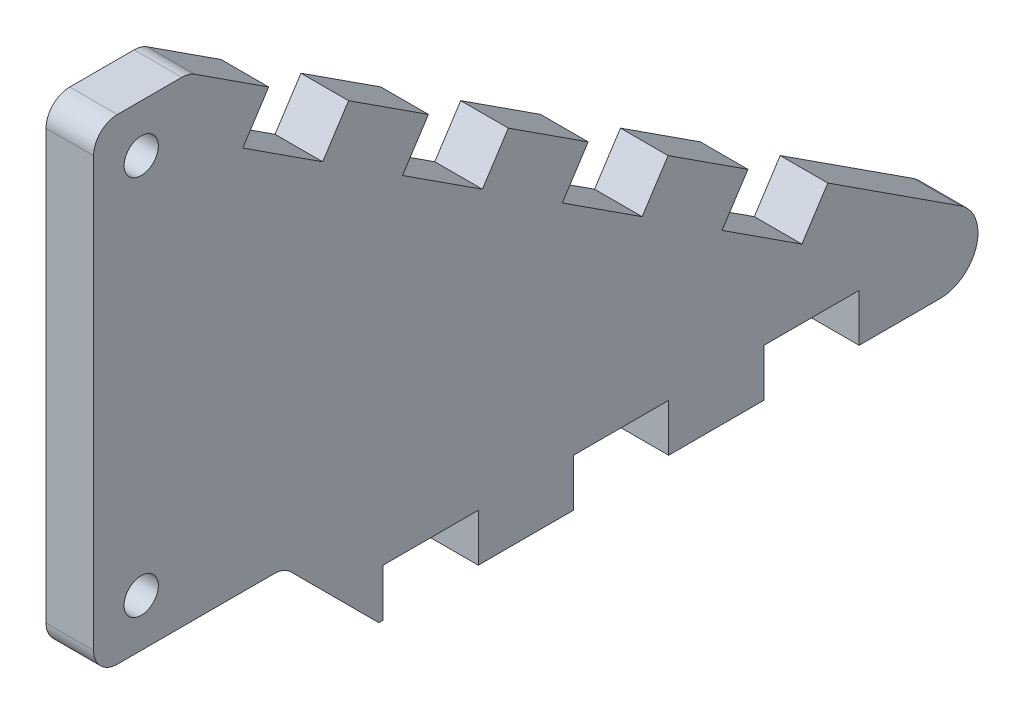
from build123d import *

# Parameters (mm, degrees)
SKETCH2_R           = 2.286
MAIN_DEPTH          = 6.35
SKETCH5_W           = 12.7
SKETCH5_H           = 6.35
ACRYLIC_JOINT_DEPTH = 115.844801624
FILLET4_R           = 3.175
FILLET5_R           = 5.08


with BuildPart() as part:
    # Sketch2 → Main (new body)
    with BuildSketch(Plane(origin=(0, 0, 0), x_dir=(0, 0, -1), z_dir=(1, 0, 0))):
        Polygon((-77.978, 84.074), (-77.978, 20.574), (-52.578, 20.574), (-39.9415, 7.9375), (45.72, 7.9375), (52.07, 7.9375), (-65.278, 84.074), align=None)
        with Locations((-71.628, 26.924)):
            Circle(SKETCH2_R, mode=Mode.SUBTRACT)
        with Locations((-71.628, 77.724)):
            Circle(SKETCH2_R, mode=Mode.SUBTRACT)
    extrude(amount=MAIN_DEPTH)

    # Sketch5 → Acrylic Joint (cut, through all)
    with BuildSketch(Plane(origin=(6.35, 0, 0), x_dir=(0, 0, -1), z_dir=(1, 0, 0))):
        with Locations((-33.02, 11.1125)):
            Rectangle(SKETCH5_W, SKETCH5_H)
        with Locations((-7.62, 11.1125)):
            Rectangle(SKETCH5_W, SKETCH5_H)
        with Locations((17.78, 11.1125)):
            Rectangle(SKETCH5_W, SKETCH5_H)
        Polygon((19.954206046, 28.774532982), (16.497989358, 23.447520104), (5.843963602, 30.359953481), (9.30018029, 35.686966359), align=None)
        Polygon((-15.46408791, 44.184820236), (-12.007871221, 49.511833114), (-1.353845465, 42.599399736), (-4.810062154, 37.272386859), align=None)
        Polygon((-36.772139421, 58.00968699), (-33.315922733, 63.336699868), (-22.661896977, 56.424266491), (-26.118113666, 51.097253613), align=None)
        Polygon((-58.080190933, 71.834553745), (-54.623974244, 77.161566623), (-43.969948488, 70.249133245), (-47.426165177, 64.922120368), align=None)
    extrude(amount=-ACRYLIC_JOINT_DEPTH, mode=Mode.SUBTRACT)

    # Fillet4
    fillet4_edges = [part.edges().sort_by_distance(p)[0] for p in [
        (3.175, 84.074, 77.978),
        (3.175, 20.574, 77.978),
        (3.175, 84.074, 65.278),
        (3.175, 20.574, 52.578),
    ]]
    fillet(fillet4_edges, radius=FILLET4_R)

    # Fillet5
    fillet5_edges = [part.edges().sort_by_distance(p)[0] for p in [
        (3.175, 7.9375, -52.07),
    ]]
    fillet(fillet5_edges, radius=FILLET5_R)


solid = part.part
